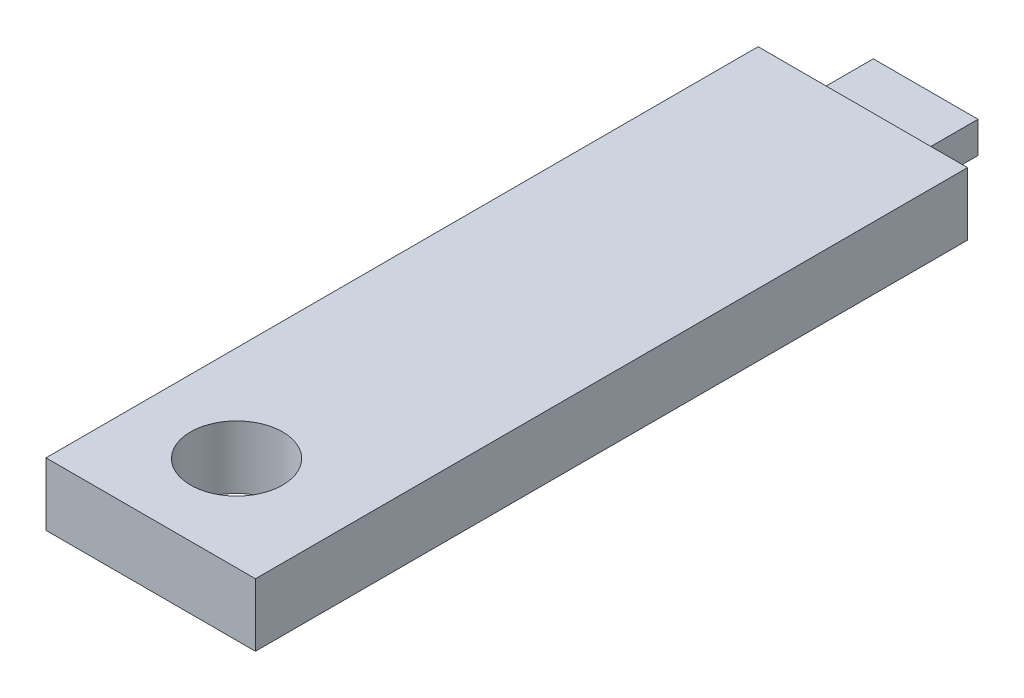
from build123d import *

# Parameters (mm, degrees)
SKETCH1_W           = 5
SKETCH1_H           = 1.5
BOSS_EXTRUDE1_DEPTH = 3
SKETCH2_W           = 10
SKETCH2_H           = 3
BOSS_EXTRUDE2_DEPTH = 34
SKETCH3_R           = 2.2
CUT_EXTRUDE1_DEPTH  = 38.871493237


with BuildPart() as part:
    # Sketch1 → Boss-Extrude1 (new body)
    with BuildSketch(Plane.XY):
        with Locations((2.5, 0.75)):
            Rectangle(SKETCH1_W, SKETCH1_H)
    extrude(amount=BOSS_EXTRUDE1_DEPTH)

    # Sketch2 → Boss-Extrude2 (add)
    with BuildSketch(Plane.XY.offset(3)):
        with Locations((2.5, 0.75)):
            Rectangle(SKETCH2_W, SKETCH2_H)
    extrude(amount=BOSS_EXTRUDE2_DEPTH)

    # Sketch3 → Cut-Extrude1 (cut, through all)
    with BuildSketch(Plane.XZ.offset(0.75)):
        with Locations((2.077057327, 32.478030561)):
            Circle(SKETCH3_R)
    extrude(amount=-CUT_EXTRUDE1_DEPTH, mode=Mode.SUBTRACT)


solid = part.part
